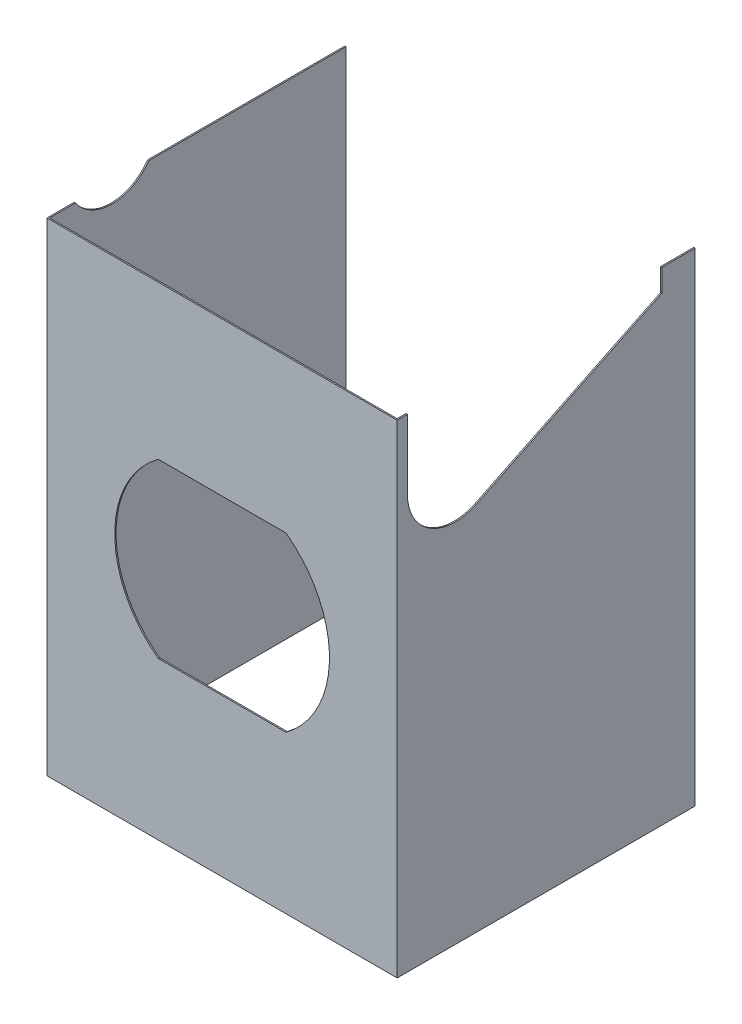
from build123d import *

# Parameters (mm, degrees)
SKETCH1_W            = 69.596
SKETCH1_H            = 96.012
BOSS_EXTRUDE1_DEPTH  = 0.254
SKETCH3_W            = 69.596
SKETCH3_H            = 0.508
BOSS_EXTRUDE2_DEPTH  = 0.254
BOSS_EXTRUDE6_DEPTH  = 0.254
FILLET6_R            = 0.254
SKETCH8_W            = 59.182
SKETCH8_H            = 96.015557392
BOSS_EXTRUDE8_DEPTH  = 0.254
CUT_EXTRUDE1_DEPTH   = 0.254
SKETCH12_W           = 59.182
SKETCH12_H           = 96.012
BOSS_EXTRUDE10_DEPTH = 0.254
SKETCH13_R           = 8.89
CUT_EXTRUDE3_DEPTH   = 0.254
SKETCH24_W           = 13.836349518
SKETCH24_H           = 43.884642402
CUT_EXTRUDE5_DEPTH   = 104.203827287


with BuildPart() as part:
    # Sketch1 → Boss-Extrude1 (new body)
    with BuildSketch(Plane.XY):
        Rectangle(SKETCH1_W, SKETCH1_H)
        with BuildLine():
            Line((12.699364984, -16.764), (-12.699364984, -16.764))
            ThreePointArc((-12.699364984, -16.764), (-21.336, 0.381), (-12.699364984, 17.526))
            Line((-12.699364984, 17.526), (12.699364984, 17.526))
            ThreePointArc((12.699364984, 17.526), (21.336, 0.381), (12.699364984, -16.764))
        make_face(mode=Mode.SUBTRACT)
    extrude(amount=-BOSS_EXTRUDE1_DEPTH)

    # Sketch3 → Boss-Extrude2 (add)
    with BuildSketch(Plane.XY):
        with Locations((0, -17.272)):
            Rectangle(SKETCH3_W, SKETCH3_H)
    extrude(amount=BOSS_EXTRUDE2_DEPTH)

    # Sketch6 → Boss-Extrude6 (add)
    with BuildSketch(Plane.XY):
        with BuildLine():
            Line((14.986, -48.006), (15.24, -48.006))
            ThreePointArc((15.24, -48.006), (0, -32.766), (-15.24, -48.006))
            Line((-15.24, -48.006), (-14.986, -48.006))
            ThreePointArc((-14.986, -48.006), (0, -33.02), (14.986, -48.006))
        make_face()
    extrude(amount=BOSS_EXTRUDE6_DEPTH)

    # Fillet6
    # the kernel refuses this fillet: 0.254 mm, written as the material it takes off along each edge
    with BuildSketch(Plane(origin=(0, -48.006, 0.254), x_dir=(-0.9990995148781596, -0.04242828502574812, 0), z_dir=(0.04242828502574812, -0.9990995148781596, 0))) as fillet6_piece_1:
        with BuildLine():
            CenterArc((14.986 + FILLET6_R, FILLET6_R), FILLET6_R, 180, 90)
            Line((14.986 + FILLET6_R, 0), (14.986, 0))
            Line((14.986, 0), (14.986, FILLET6_R))
        make_face()
    revolve(axis=Axis((0, -48.006, 0.254), (0, 0, -1)), revolution_arc=184.863383217, mode=Mode.SUBTRACT)
    with BuildSketch(Plane(origin=(0, -48.006, 0.254), x_dir=(0.9991292765937022, -0.0417215610128061, 0), z_dir=(-0.0417215610128061, -0.9991292765937022, 0))) as fillet6_piece_2:
        with BuildLine():
            CenterArc((15.24 - FILLET6_R, -FILLET6_R), FILLET6_R, 0, 90)
            Line((15.24 - FILLET6_R, 0), (15.24, 0))
            Line((15.24, 0), (15.24, -FILLET6_R))
        make_face()
    revolve(axis=Axis((0, -48.006, 0.254), (0, 0, 1)), revolution_arc=184.78232683, mode=Mode.SUBTRACT)

    # Sketch8 → Boss-Extrude8 (add)
    with BuildSketch(Plane(origin=(34.798, 0, 0), x_dir=(0, 0, -1), z_dir=(1, 0, 0))):
        with Locations((29.591, 0.001778696)):
            Rectangle(SKETCH8_W, SKETCH8_H)
    extrude(amount=-BOSS_EXTRUDE8_DEPTH)

    # Sketch9 → Cut-Extrude1 (cut)
    with BuildSketch(Plane(origin=(34.798, 0, 0), x_dir=(0, 0, -1), z_dir=(1, 0, 0))):
        with BuildLine():
            Line((2.032, 34.225901784), (2.032, 48.009557392))
            Line((2.032, 48.009557392), (52.578, 48.009557392))
            Line((52.578, 48.009557392), (52.578, 43.536362147))
            Line((52.578, 43.536362147), (15.713824639, 25.655812291))
            ThreePointArc((15.713824639, 25.655812291), (6.500723192, 26.153746568), (2.032, 34.225901784))
        make_face()
    extrude(amount=-CUT_EXTRUDE1_DEPTH, mode=Mode.SUBTRACT)

    # Sketch12 → Boss-Extrude10 (add)
    with BuildSketch(Plane(origin=(-34.798, 0, 0), x_dir=(0, 0, -1), z_dir=(1, 0, 0))):
        with Locations((29.591, 0)):
            Rectangle(SKETCH12_W, SKETCH12_H)
    extrude(amount=BOSS_EXTRUDE10_DEPTH)

    # Sketch13 → Cut-Extrude3 (cut)
    with BuildSketch(Plane.ZY.offset(34.798)):
        with Locations((-12.7, 53.086)):
            Circle(SKETCH13_R)
    extrude(amount=-CUT_EXTRUDE3_DEPTH, mode=Mode.SUBTRACT)

    # Sketch24 → Cut-Extrude5 (cut, through all)
    with BuildSketch(Plane(origin=(34.798, 0, 0), x_dir=(0, 0, -1), z_dir=(1, 0, 0))):
        with Locations((-6.918174759, -26.063678799)):
            Rectangle(SKETCH24_W, SKETCH24_H)
    extrude(amount=-CUT_EXTRUDE5_DEPTH, mode=Mode.SUBTRACT)


solid = part.part
